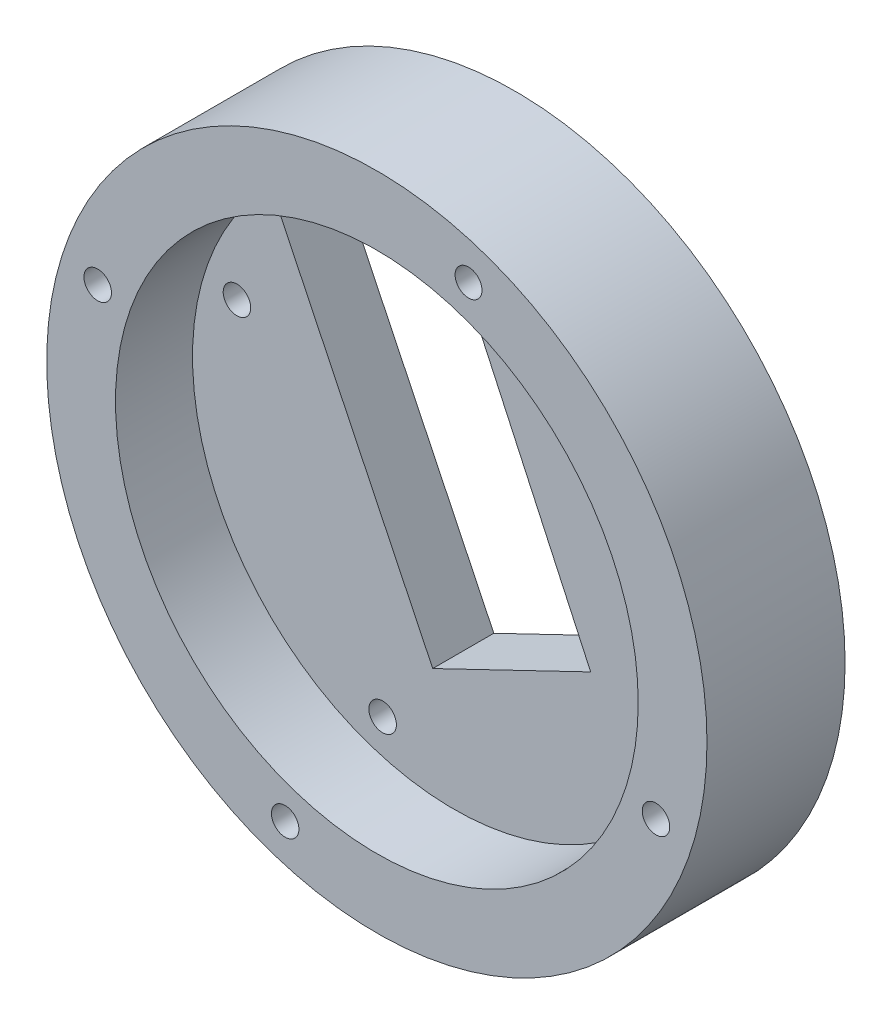
from build123d import *

# Parameters (mm, degrees)
SKETCH1_R               = 60
BOSS_EXTRUDE1_DEPTH     = 25.1
SKETCH3_R               = 47.5
CUT_EXTRUDE2_DEPTH      = 14
CUT_EXTRUDE5_DEPTH      = 89.487343728
CUT_EXTRUDE5_DEPTH_BACK = 89.487343728
SKETCH2_R               = 2.494998654
SKETCH2_R_2             = 2.5
SKETCH2_R_3             = 2.444443829
SKETCH6_R               = 3
CUT_EXTRUDE6_DEPTH      = 6
CUT_EXTRUDE7_DEPTH      = 87
CUT_EXTRUDE7_DEPTH_BACK = 87
SKETCH8_R               = 2.5
CUT_EXTRUDE8_DEPTH      = 81


with BuildPart() as part:
    # Sketch1 → Boss-Extrude1 (new body)
    with BuildSketch(Plane.XY):
        Circle(SKETCH1_R)
    extrude(amount=BOSS_EXTRUDE1_DEPTH)

    # Sketch3 → Cut-Extrude2 (cut)
    with BuildSketch(Plane.XY.offset(25.1)):
        Circle(SKETCH3_R)
    extrude(amount=-CUT_EXTRUDE2_DEPTH, mode=Mode.SUBTRACT)

    # Sketch2 → Cut-Extrude5 (cut, two sides: drawn at the far end of the back side and taken through both)
    with BuildSketch(Plane.XY.offset(25.1).offset(-CUT_EXTRUDE5_DEPTH_BACK)):
        with Locations((-16.664697145, -50.733104448)):
            Circle(SKETCH2_R)
        with Locations((-50.733105114, 16.664696544)):
            Circle(SKETCH2_R_2)
        with Locations((16.664695878, 50.733104512)):
            Circle(SKETCH2_R_3)
        with Locations((50.733103846, -16.66469648)):
            Circle(SKETCH2_R_2)
    extrude(amount=CUT_EXTRUDE5_DEPTH + CUT_EXTRUDE5_DEPTH_BACK, mode=Mode.SUBTRACT)

    # Sketch6 → Cut-Extrude6 (cut)
    with BuildSketch(Plane(origin=(0, 0, 0), x_dir=(-1, 0, 0), z_dir=(0, 0, -1))):
        with Locations((11.973502988, 47.212610548)):
            Circle(SKETCH6_R)
        with Locations((27.381285989, 40.029281029)):
            Circle(SKETCH6_R)
        with Locations((-19.717656658, -20.762902692)):
            Circle(SKETCH6_R)
        with Locations((-4.309873657, -27.946232212)):
            Circle(SKETCH6_R)
    extrude(amount=-CUT_EXTRUDE6_DEPTH, mode=Mode.SUBTRACT)

    # Sketch7 → Cut-Extrude7 (cut, two sides: drawn at the far end of the back side and taken through both)
    with BuildSketch(Plane.XY.offset(11.1).offset(-CUT_EXTRUDE7_DEPTH_BACK)):
        Polygon((-32.722381774, 32.714358343), (-3.845549598, -27.273283804), (24.859322702, -13.455341469), (-3.0425496, 47.001626555), align=None)
    extrude(amount=CUT_EXTRUDE7_DEPTH + CUT_EXTRUDE7_DEPTH_BACK, mode=Mode.SUBTRACT)

    # Sketch8 → Cut-Extrude8 (cut)
    with BuildSketch(Plane(origin=(0, 0, 0), x_dir=(-1, 0, 0), z_dir=(0, 0, -1))):
        with Locations((-39.427412605, -12.951028347)):
            Circle(SKETCH8_R)
        with Locations((-12.951028347, 39.427412605)):
            Circle(SKETCH8_R)
        with Locations((39.427412605, 12.951028347)):
            Circle(SKETCH8_R)
        with Locations((12.951028347, -39.427412605)):
            Circle(SKETCH8_R)
    extrude(amount=-CUT_EXTRUDE8_DEPTH, mode=Mode.SUBTRACT)


solid = part.part
